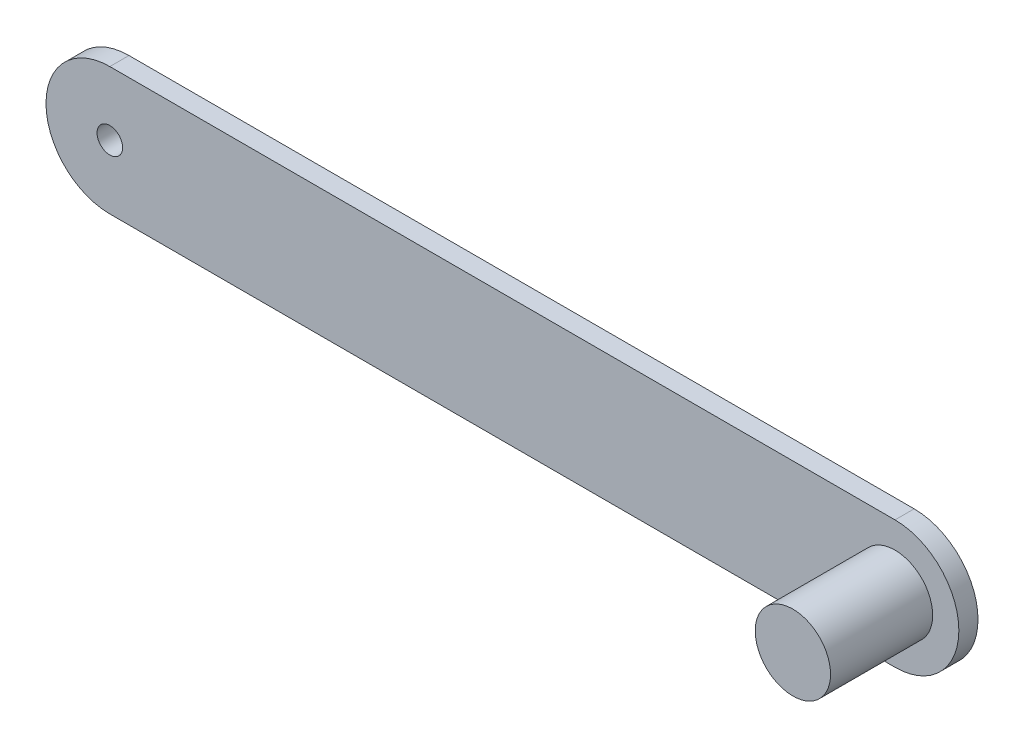
from build123d import *

# Parameters (mm, degrees)
BOSS_EXTRUDE4_DEPTH = 1.5
SKETCH4_R           = 1
CUT_EXTRUDE1_DEPTH  = 67.704572557
SKETCH5_R           = 2.95
BOSS_EXTRUDE5_DEPTH = 8


with BuildPart() as part:
    # Sketch1 → Boss-Extrude4 (new body)
    with BuildSketch(Plane.XY):
        with BuildLine():
            Line((0, 5), (61.5, 5))
            ThreePointArc((61.5, 5), (66.5, 0), (61.5, -5))
            Line((61.5, -5), (0, -5))
            ThreePointArc((0, -5), (-5, 0), (0, 5))
        make_face()
    extrude(amount=BOSS_EXTRUDE4_DEPTH)

    # Sketch4 → Cut-Extrude1 (cut, through all)
    with BuildSketch(Plane.XY.offset(1.5)):
        Circle(SKETCH4_R)
    extrude(amount=-CUT_EXTRUDE1_DEPTH, mode=Mode.SUBTRACT)

    # Sketch5 → Boss-Extrude5 (add)
    with BuildSketch(Plane.XY.offset(1.5)):
        with Locations((61.5, 0)):
            Circle(SKETCH5_R)
    extrude(amount=BOSS_EXTRUDE5_DEPTH)


solid = part.part
